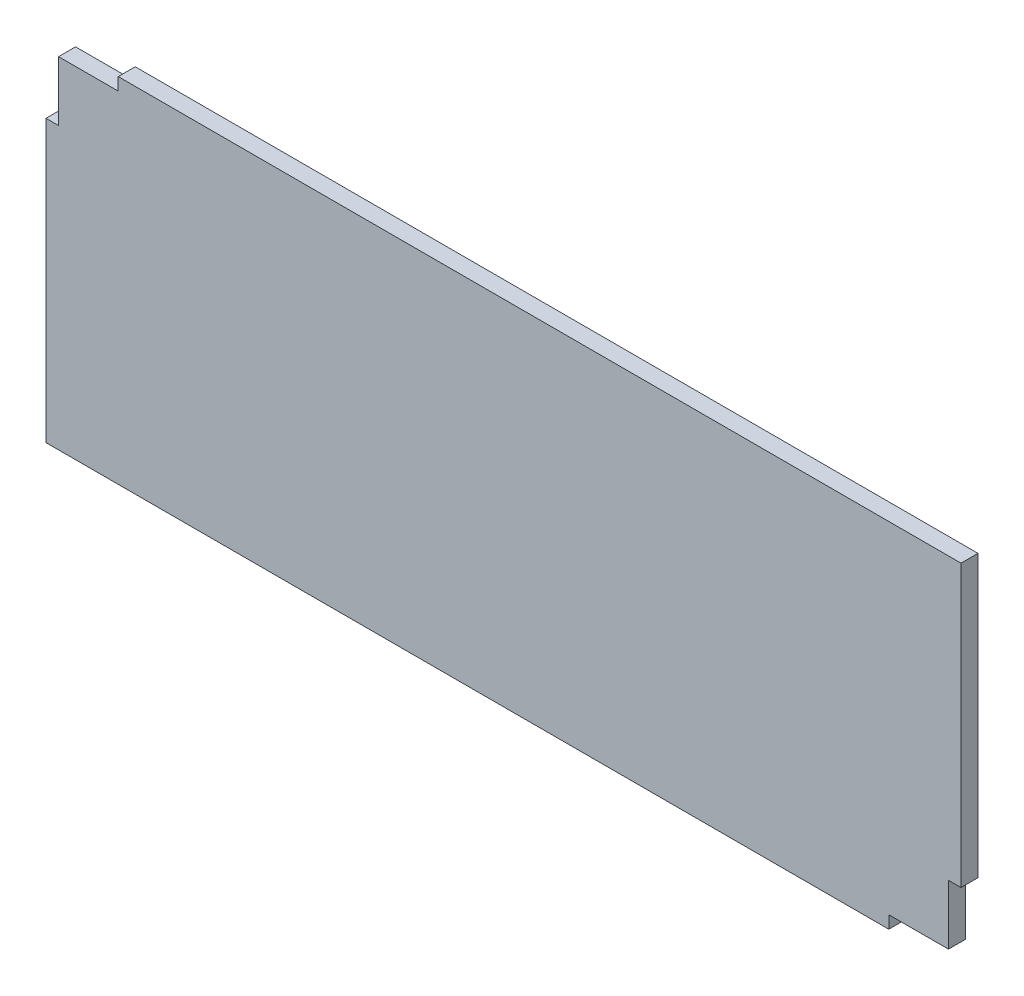
from build123d import *

# Parameters (mm, degrees)
BOSS_EXTRUDE1_DEPTH = 6.35


with BuildPart() as part:
    # Sketch1 → Boss-Extrude1 (new body)
    with BuildSketch(Plane.XY):
        Polygon((27, 132), (27, 127.3), (4.7, 127.3), (4.7, 105), (0, 105), (0, 0), (315, 0), (315, 4.7), (337.3, 4.7), (337.3, 27), (342, 27), (342, 132), align=None)
    extrude(amount=BOSS_EXTRUDE1_DEPTH)


solid = part.part
